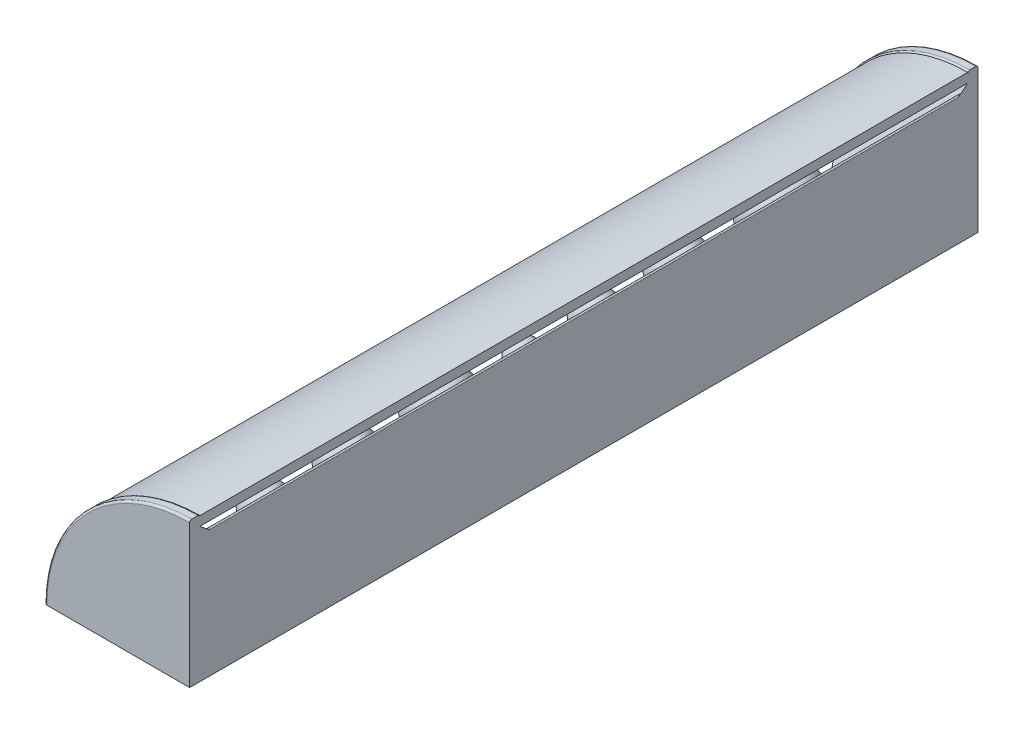
from build123d import *

# Parameters (mm, degrees)
BOSS_EXTRUDE1_DEPTH          = 1.27
BOSS_EXTRUDE2_DEPTH          = 94.234
FILLET1_R                    = 0.254
SKETCH5_W                    = 23.348665914
SKETCH5_H                    = 94.234
CUT_EXTRUDE1_DEPTH           = 12.7
CUT_EXTRUDE1_OTHER_WAY_DEPTH = 5.08
CUT_EXTRUDE1_OTHER_WAY_TAPER = 60
FILLET2_R                    = 0.127
SKETCH6_R                    = 3.81
SKETCH6_R_2                  = 5.715
SKETCH6_R_3                  = 5.08
SKETCH6_R_4                  = 4.445
SKETCH6_R_5                  = 6.35
BOSS_EXTRUDE3_DEPTH          = 3.81
FILLET3_R                    = 1.27
BOSS_EXTRUDE4_DEPTH          = 94.234


with BuildPart() as part:
    # Sketch2 → Boss-Extrude1 (new body)
    with BuildSketch(Plane.XY):
        with BuildLine():
            Line((0, 17.78), (0, 0))
            Line((0, 0), (-17.78, 0))
            ThreePointArc((-17.78, 0), (-12.572358569, 12.572358569), (0, 17.78))
        make_face()
    boss_extrude1 = extrude(amount=-BOSS_EXTRUDE1_DEPTH)

    # Sketch4 → Boss-Extrude2 (add)
    with BuildSketch(Plane(origin=(0, 0, -1.27), x_dir=(-1, 0, 0), z_dir=(0, 0, -1))):
        with BuildLine():
            Line((0, 16.51), (0, 0))
            Line((0, 0), (16.51, 0))
            ThreePointArc((16.51, 0), (11.674332957, 11.674332957), (0, 16.51))
        make_face()
    extrude(amount=BOSS_EXTRUDE2_DEPTH)

    # Mirror1: Boss-Extrude1 across plane
    add(boss_extrude1.mirror(Plane(origin=(0, 0, -48.387), x_dir=(1, 0, 0), z_dir=(0, 0, -1))))

    # Fillet1
    fillet1_edges = [part.edges().sort_by_distance(p)[0] for p in [
        (-12.572358569, 12.572358569, -1.27),
        (-12.572358569, 12.572358569, -95.504),
        (-12.572358569, 12.572358569, 0),
        (-12.572358569, 12.572358569, -96.774),
    ]]
    fillet(fillet1_edges, radius=FILLET1_R)

    # Sketch5 → Cut-Extrude1 (cut)
    with BuildSketch(Plane(origin=(-8.255, 8.255, 0), x_dir=(0.7071067811865476, 0.7071067811865475, 0), z_dir=(-0.7071067811865475, 0.7071067811865476, 0))):
        with Locations((0, 48.387)):
            Rectangle(SKETCH5_W, SKETCH5_H)
    extrude(amount=CUT_EXTRUDE1_DEPTH, mode=Mode.SUBTRACT)

    # Sketch5 → Cut-Extrude1 other way (cut)
    with BuildSketch(Plane(origin=(-8.255, 8.255, 0), x_dir=(0.7071067811865476, 0.7071067811865475, 0), z_dir=(-0.7071067811865475, 0.7071067811865476, 0))):
        with Locations((0, 48.387)):
            Rectangle(SKETCH5_W, SKETCH5_H)
    extrude(amount=-CUT_EXTRUDE1_OTHER_WAY_DEPTH, taper=CUT_EXTRUDE1_OTHER_WAY_TAPER, mode=Mode.SUBTRACT)

    # Fillet2
    fillet2_edges = [part.edges().sort_by_distance(p)[0] for p in [
        (-16.51, 0, -48.387),
        (0, 16.51, -48.387),
    ]]
    fillet(fillet2_edges, radius=FILLET2_R)

    # Sketch6 → Boss-Extrude3 (add)
    with BuildSketch(Plane(origin=(-4.662897552, 4.662897552, 0), x_dir=(0, 0, 1), z_dir=(-0.7071067811865476, 0.7071067811865476, 0))):
        with Locations((-48.387, 0)):
            Circle(SKETCH6_R)
        with Locations((-38.227, 0)):
            Circle(SKETCH6_R_2)
        with Locations((-26.797, 0)):
            Circle(SKETCH6_R_3)
        with Locations((-16.637, 0)):
            Circle(SKETCH6_R_4)
        with Locations((-57.277, 0)):
            Circle(SKETCH6_R_4)
        with Locations((-67.437, 0)):
            Circle(SKETCH6_R_3)
        with Locations((-80.137, 0)):
            Circle(SKETCH6_R_5)
    extrude(amount=BOSS_EXTRUDE3_DEPTH)

    # Fillet3
    fillet3_edges = [part.edges().sort_by_distance(p)[0] for p in [
        (-7.356974388, 7.356974388, -21.082),
        (-7.356974388, 7.356974388, -31.877),
        (-7.356974388, 7.356974388, -43.942),
        (-7.356974388, 7.356974388, -52.197),
        (-7.356974388, 7.356974388, -61.722),
        (-7.356974388, 7.356974388, -72.517),
        (-7.356974388, 7.356974388, -86.487),
    ]]
    fillet(fillet3_edges, radius=FILLET3_R)

    # Sketch7 → Revolve1 (revolve)
    with BuildSketch(Plane(origin=(-7.356974388, 7.356974388, 0), x_dir=(0, 0, 1), z_dir=(-0.7071067811865477, 0.7071067811865475, 0))):
        with BuildLine():
            ThreePointArc((-75.692, 0), (-80.137, 4.445), (-84.582, 0))
            Line((-84.582, 0), (-75.692, 0))
        make_face()
        with BuildLine():
            ThreePointArc((-64.262, 0), (-67.437, 3.175), (-70.612, 0))
            Line((-70.612, 0), (-64.262, 0))
        make_face()
        with BuildLine():
            ThreePointArc((-54.737, 0), (-57.277, 2.54), (-59.817, 0))
            Line((-59.817, 0), (-54.737, 0))
        make_face()
        with BuildLine():
            ThreePointArc((-46.482, 0), (-48.387, 1.905), (-50.292, 0))
            Line((-50.292, 0), (-46.482, 0))
        make_face()
        with BuildLine():
            ThreePointArc((-34.417, 0), (-38.227, 3.81), (-42.037, 0))
            Line((-42.037, 0), (-34.417, 0))
        make_face()
        with BuildLine():
            Line((-23.622, 0), (-29.972, 0))
            ThreePointArc((-29.972, 0), (-26.797, -3.175), (-23.622, 0))
        make_face()
        with BuildLine():
            Line((-14.097, 0), (-19.177, 0))
            ThreePointArc((-19.177, 0), (-16.637, -2.54), (-14.097, 0))
        make_face()
    revolve(axis=Axis((-7.356974388, 7.356974388, -85.217), (0, 0, 1)))

    # Sketch8 → Boss-Extrude4 (add)
    with BuildSketch(Plane.XY.offset(-95.504)):
        with BuildLine():
            Line((-0.64824067, 15.86175933), (0, 16.51))
            Line((0, 16.51), (0, 17.653))
            ThreePointArc((0, 17.653), (-12.482556008, 12.482556008), (-17.653, 0))
            Line((-17.653, 0), (-16.51, 0))
            Line((-16.51, 0), (-15.86175933, 0.64824067))
            ThreePointArc((-15.86175933, 0.64824067), (-11.225320151, 11.225320151), (-0.64824067, 15.86175933))
        make_face()
    extrude(amount=BOSS_EXTRUDE4_DEPTH)


solid = part.part
